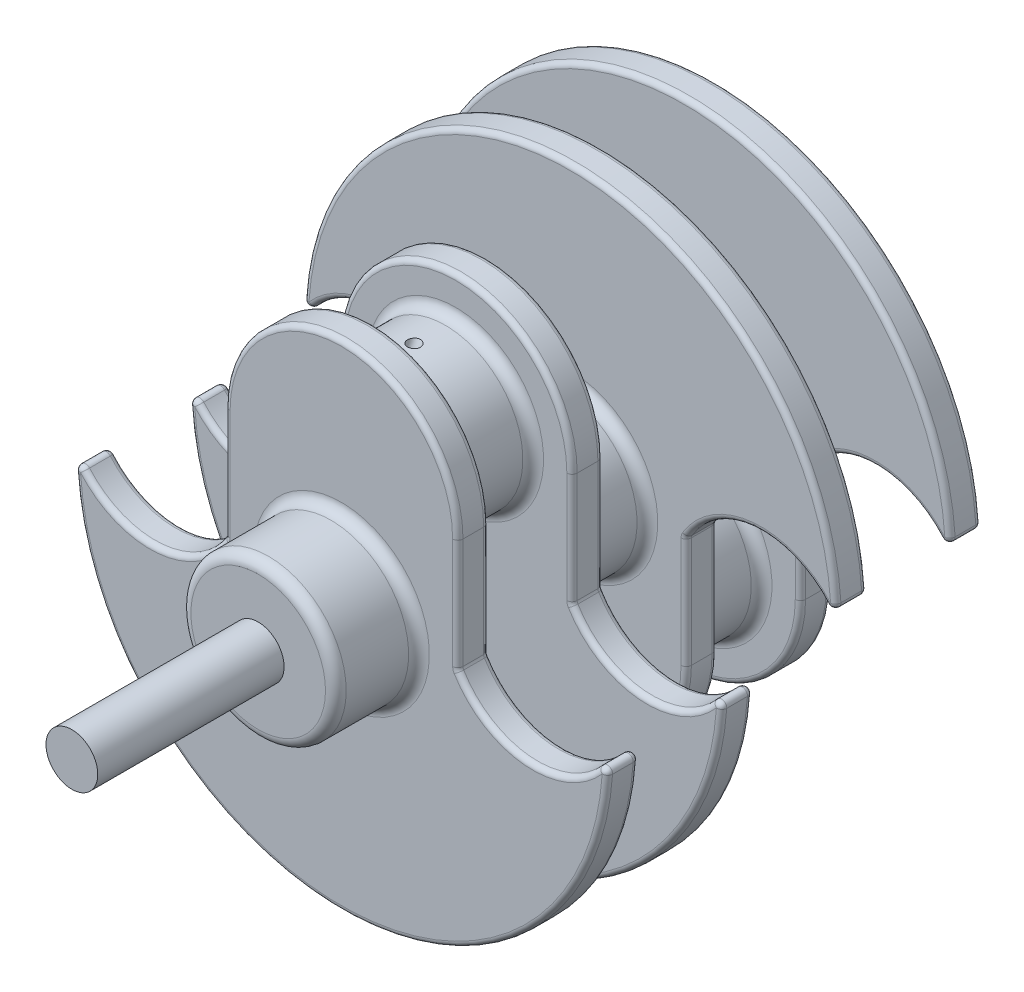
from build123d import *
from build123d.topology import SkipClean

# Parameters (mm, degrees)
SKETCH1_R               = 30
BOSS_EXTRUDE1_DEPTH     = 32.13
BOSS_EXTRUDE5_DEPTH     = 12
SKETCH2_R               = 10
BOSS_EXTRUDE2_DEPTH     = 20
SKETCH9_R               = 30
BOSS_EXTRUDE6_DEPTH     = 32.13
BOSS_EXTRUDE7_START     = 44.13
BOSS_EXTRUDE7_DEPTH     = 12
BOSS_EXTRUDE8_DEPTH     = 12
BOSS_EXTRUDE9_REACH     = 212.81
SKETCH14_R              = 30
BOSS_EXTRUDE10_START    = 32.13
SKETCH15_R              = 30
BOSS_EXTRUDE10_DEPTH    = 32.13
BOSS_EXTRUDE11_START    = 20
SKETCH16_R              = 10
BOSS_EXTRUDE11_DEPTH    = 20
BOSS_EXTRUDE12_DEPTH    = 12
BOSS_EXTRUDE13_REACH    = 204.305
SKETCH19_R              = 30
FILLET1_R               = 2
FILLET2_R               = 2
FILLET3_R               = 2
FILLET5_R               = 4
FILLET6_R               = 4
FILLET7_R               = 4
SKETCH48_RX             = 2.5
SKETCH48_RY             = 2.298656771
CUT_EXTRUDE2_DEPTH      = 272.011630343
SKETCH49_R              = 2.5
CUT_EXTRUDE3_DEPTH      = 265.555190064
SKETCH50_R              = 2.5
CUT_EXTRUDE4_DEPTH      = 272.874725345
CUT_EXTRUDE5_DEPTH      = 265.555190064
CUT_EXTRUDE5_DEPTH_BACK = 265.555190064
SKETCH52_RX             = 2.5
SKETCH52_RY             = 2.298656771
SKETCH53_R              = 10
BOSS_EXTRUDE14_DEPTH    = 52


with BuildPart() as part:
    # Sketch1 → Boss-Extrude1 (new body)
    with BuildSketch(Plane.XY):
        Circle(SKETCH1_R)
    extrude(amount=BOSS_EXTRUDE1_DEPTH)

    # Sketch8 → Boss-Extrude5 (add)
    with BuildSketch(Plane(origin=(0, 0, 0), x_dir=(-1, 0, 0), z_dir=(0, 0, -1))):
        with BuildLine():
            Line((-45, 43.2), (-45, 0))
            ThreePointArc((-45, 0), (-74, -16.683015525), (-103, 0))
            ThreePointArc((-103, 0), (0, -103), (103, 0))
            ThreePointArc((103, 0), (74, -16.683015525), (45, 0))
            Line((45, 0), (45, 43.2))
            ThreePointArc((45, 43.2), (0, 88.2), (-45, 43.2))
        make_face()
    extrude(amount=BOSS_EXTRUDE5_DEPTH)

    # Sketch2 → Boss-Extrude2 (add)
    with BuildSketch(Plane.XY.offset(32.13)):
        Circle(SKETCH2_R)
    extrude(amount=BOSS_EXTRUDE2_DEPTH)

    # Sketch9 → Boss-Extrude6 (add)
    with BuildSketch(Plane(origin=(0, 0, -12), x_dir=(-1, 0, 0), z_dir=(0, 0, -1))):
        with Locations((0, 43.2)):
            Circle(SKETCH9_R)
    extrude(amount=BOSS_EXTRUDE6_DEPTH)

    # Sketch18 → Boss-Extrude12 (add)
    with BuildSketch(Plane(origin=(0, 0, -44.13), x_dir=(-1, 0, 0), z_dir=(0, 0, -1))):
        with BuildLine():
            Line((-45, 43.2), (-45, 0))
            ThreePointArc((-45, 0), (-74, -16.683015525), (-103, 0))
            ThreePointArc((-103, 0), (0, -103), (103, 0))
            ThreePointArc((103, 0), (74, -16.683015525), (45, 0))
            Line((45, 0), (45, 43.2))
            ThreePointArc((45, 43.2), (0, 88.2), (-45, 43.2))
        make_face()
    extrude(amount=BOSS_EXTRUDE12_DEPTH)



with BuildPart() as body_2:
    # Sketch10 → Boss-Extrude7 (new body)
    with BuildSketch(Plane(origin=(0, 0, -44.13), x_dir=(-1, 0, 0), z_dir=(0, 0, -1)).offset(BOSS_EXTRUDE7_START)):
        with BuildLine():
            Line((-45, -43.2), (-45, 0))
            ThreePointArc((-45, 0), (-74, 16.683015525), (-103, 0))
            ThreePointArc((-103, 0), (0, 103), (103, 0))
            ThreePointArc((103, 0), (74, 16.683015525), (45, 0))
            Line((45, 0), (45, -43.2))
            ThreePointArc((45, -43.2), (0, -88.2), (-45, -43.2))
        make_face()
    extrude(amount=BOSS_EXTRUDE7_DEPTH)


with BuildPart() as body_3:
    # Sketch12 → Boss-Extrude8 (new body)
    with BuildSketch(Plane(origin=(0, 0, -132.39), x_dir=(-1, 0, 0), z_dir=(0, 0, -1))):
        with BuildLine():
            Line((45, -43.2), (45, 0))
            ThreePointArc((45, 0), (74, 16.683015525), (103, 0))
            ThreePointArc((103, 0), (0, 103), (-103, 0))
            ThreePointArc((-103, 0), (-74, 16.683015525), (-45, 0))
            Line((-45, 0), (-45, -43.2))
            ThreePointArc((-45, -43.2), (0, -88.2), (45, -43.2))
        make_face()
    extrude(amount=BOSS_EXTRUDE8_DEPTH)

    # Sketch14 → Boss-Extrude9 (add, up to next)
    with BuildSketch(Plane(origin=(0, 0, -100.26), x_dir=(-1, 0, 0), z_dir=(0, 0, -1)), mode=Mode.PRIVATE) as boss_extrude9_sk1:
        with Locations((0, -43.2)):
            Circle(SKETCH14_R)
    boss_extrude9_tool1 = extrude(boss_extrude9_sk1.sketch, amount=BOSS_EXTRUDE9_REACH, mode=Mode.PRIVATE) - body_3.part
    add(boss_extrude9_tool1.solids().sort_by_distance((0, -43.2, -100.26))[0])

    # Sketch15 → Boss-Extrude10 (add)
    with BuildSketch(Plane(origin=(0, 0, -144.39), x_dir=(-1, 0, 0), z_dir=(0, 0, -1)).offset(BOSS_EXTRUDE10_START)):
        Circle(SKETCH15_R)
    extrude(amount=-BOSS_EXTRUDE10_DEPTH)

    # Sketch16 → Boss-Extrude11 (add)
    with BuildSketch(Plane(origin=(0, 0, -176.52), x_dir=(-1, 0, 0), z_dir=(0, 0, -1)).offset(BOSS_EXTRUDE11_START)):
        Circle(SKETCH16_R)
    extrude(amount=-BOSS_EXTRUDE11_DEPTH)

    # Fillet2
    fillet2_edges = [body_3.edges().sort_by_distance(p)[0] for p in [
        (-103, 0, -138.39),
        (-45, 0, -138.39),
        (45, 0, -138.39),
        (103, 0, -138.39),
        (45, -21.6, -144.39),
        (0, -88.2, -144.39),
        (-45, -21.6, -144.39),
        (-74, 16.683015525, -144.39),
        (0, 103, -144.39),
        (-74, 16.683015525, -132.39),
        (-45, -21.6, -132.39),
        (0, -88.2, -132.39),
        (45, -21.6, -132.39),
        (74, 16.683015525, -132.39),
        (0, 103, -132.39),
        (74, 16.683015525, -144.39),
    ]]
    fillet(fillet2_edges, radius=FILLET2_R)

    # Fillet6
    fillet6_edges = [body_3.edges().sort_by_distance(p)[0] for p in [
        (30, 0, -144.39),
        (30, 0, -176.52),
    ]]
    fillet(fillet6_edges, radius=FILLET6_R)


with BuildPart() as part_1:
    add(part.part)

    # Sketch19 → Boss-Extrude13 (add, up to next)
    with BuildSketch(Plane(origin=(0, 0, -56.13), x_dir=(-1, 0, 0), z_dir=(0, 0, -1)), mode=Mode.PRIVATE) as boss_extrude13_sk1:
        Circle(SKETCH19_R)
    boss_extrude13_tool1 = extrude(boss_extrude13_sk1.sketch, amount=BOSS_EXTRUDE13_REACH, mode=Mode.PRIVATE) - body_2.part
    add(boss_extrude13_tool1.solids().sort_by_distance((0, 0, -56.13))[0])

    # Fillet1
    fillet1_edges = [part_1.edges().sort_by_distance(p)[0] for p in [
        (-45, 21.6, -12),
        (0, -103, -44.13),
        (103, 0, -50.13),
        (-74, -16.683015525, -44.13),
        (-103, 0, -50.13),
        (-45, 21.6, -44.13),
        (-45, 0, -50.13),
        (0, 88.2, -44.13),
        (45, 21.6, -44.13),
        (74, -16.683015525, -44.13),
        (45, 0, -50.13),
        (0, -103, -56.13),
        (-74, -16.683015525, -56.13),
        (-45, 21.6, -56.13),
        (0, 88.2, -56.13),
        (45, 21.6, -56.13),
        (74, -16.683015525, -56.13),
        (0, 88.2, 0),
        (45, 21.6, 0),
        (74, -16.683015525, 0),
        (45, 0, -6),
        (0, -103, 0),
        (103, 0, -6),
        (-74, -16.683015525, 0),
        (-103, 0, -6),
        (-45, 21.6, 0),
        (-45, 0, -6),
        (0, 88.2, -12),
        (45, 21.6, -12),
        (74, -16.683015525, -12),
        (0, -103, -12),
        (-74, -16.683015525, -12),
    ]]
    fillet(fillet1_edges, radius=FILLET1_R)

    # Fillet5
    fillet5_edges = [part_1.edges().sort_by_distance(p)[0] for p in [
        (-30, 0, 32.13),
        (-30, 0, 0),
    ]]
    fillet(fillet5_edges, radius=FILLET5_R)


with BuildPart() as body_2_1:
    add(body_2.part)

    # Fillet3
    fillet3_edges = [body_2_1.edges().sort_by_distance(p)[0] for p in [
        (-45, 0, -94.26),
        (-103, 0, -94.26),
        (103, 0, -94.26),
        (45, 0, -94.26),
        (0, 103, -100.26),
        (-74, 16.683015525, -100.26),
        (-45, -21.6, -100.26),
        (0, -88.2, -100.26),
        (45, -21.6, -100.26),
        (0, -88.2, -88.26),
        (-45, -21.6, -88.26),
        (-74, 16.683015525, -88.26),
        (0, 103, -88.26),
        (74, 16.683015525, -88.26),
        (45, -21.6, -88.26),
        (74, 16.683015525, -100.26),
    ]]
    fillet(fillet3_edges, radius=FILLET3_R)


with BuildPart() as part_2:
    add(part_1.part)

    # Combine1: union body 2, body 3
    add(body_2_1.part)
    add(body_3.part)

    # Fillet7
    fillet7_edges = [part_2.edges().sort_by_distance(p)[0] for p in [
        (30, -43.2, -100.26),
        (30, -43.2, -132.39),
        (30, 43.2, -12),
        (30, 43.2, -44.13),
        (30, 0, -56.13),
        (30, 0, -88.26),
    ]]
    fillet(fillet7_edges, radius=FILLET7_R)

    # Sketch48 → Cut-Extrude2 (cut, through all)
    with BuildSketch(Plane(origin=(0, -30, 16.065), x_dir=(-1, 0, 0), z_dir=(0, -0.9194627083430198, 0.39317722208505296))):
        with Locations((0, 0)):
            Ellipse(SKETCH48_RX, SKETCH48_RY)
    extrude(amount=-CUT_EXTRUDE2_DEPTH, mode=Mode.SUBTRACT)

    # Sketch49 → Cut-Extrude3 (cut, through all)
    with BuildSketch(Plane(origin=(0, -73.2, -116.325), x_dir=(-1, 0, 0), z_dir=(0, -0.9218220972740562, 0.3876132363287671))):
        with Locations(Location((0, 0, 0), (0, 0, 90))):
            Circle(SKETCH49_R)
    extrude(amount=-CUT_EXTRUDE3_DEPTH, mode=Mode.SUBTRACT)

    # Sketch50 → Cut-Extrude4 (cut, through all)
    with SkipClean():  # the faces are left unmerged after this step: merging them gives an invalid solid
        with BuildSketch(Plane(origin=(0, 31.75, -160.455), x_dir=(-1, 0, 0), z_dir=(0, -0.9218220972740562, 0.3876132363287671))):
            with Locations(Location((0, 0, 0), (0, 0, 90))):
                Circle(SKETCH50_R)
        extrude(amount=CUT_EXTRUDE4_DEPTH, mode=Mode.SUBTRACT)
    add(part_2.part.scale(1), mode=Mode.REPLACE)  # the faces are merged on a copy

    # Sketch52 → Cut-Extrude5 (cut, two sides: drawn at the far end of the back side and taken through both)
    with BuildSketch(Plane(origin=(0, 73.2, -28.065), x_dir=(-1, 0, 0), z_dir=(0, -0.9194627083430198, 0.39317722208505296)).offset(-CUT_EXTRUDE5_DEPTH_BACK)):
        with Locations((0, 0)):
            Ellipse(SKETCH52_RX, SKETCH52_RY)
    extrude(amount=CUT_EXTRUDE5_DEPTH + CUT_EXTRUDE5_DEPTH_BACK, mode=Mode.SUBTRACT)

    # Sketch53 → Boss-Extrude14 (add)
    with SkipClean():  # the faces are left unmerged after this step: merging them gives an invalid solid
        with BuildSketch(Plane(origin=(0, 0, 52.13), x_dir=(-1, 0, 0), z_dir=(0, 0, -1))):
            Circle(SKETCH53_R)
        extrude(amount=-BOSS_EXTRUDE14_DEPTH)
    add(part_2.part.scale(1), mode=Mode.REPLACE)  # the faces are merged on a copy


solid = part_2.part
